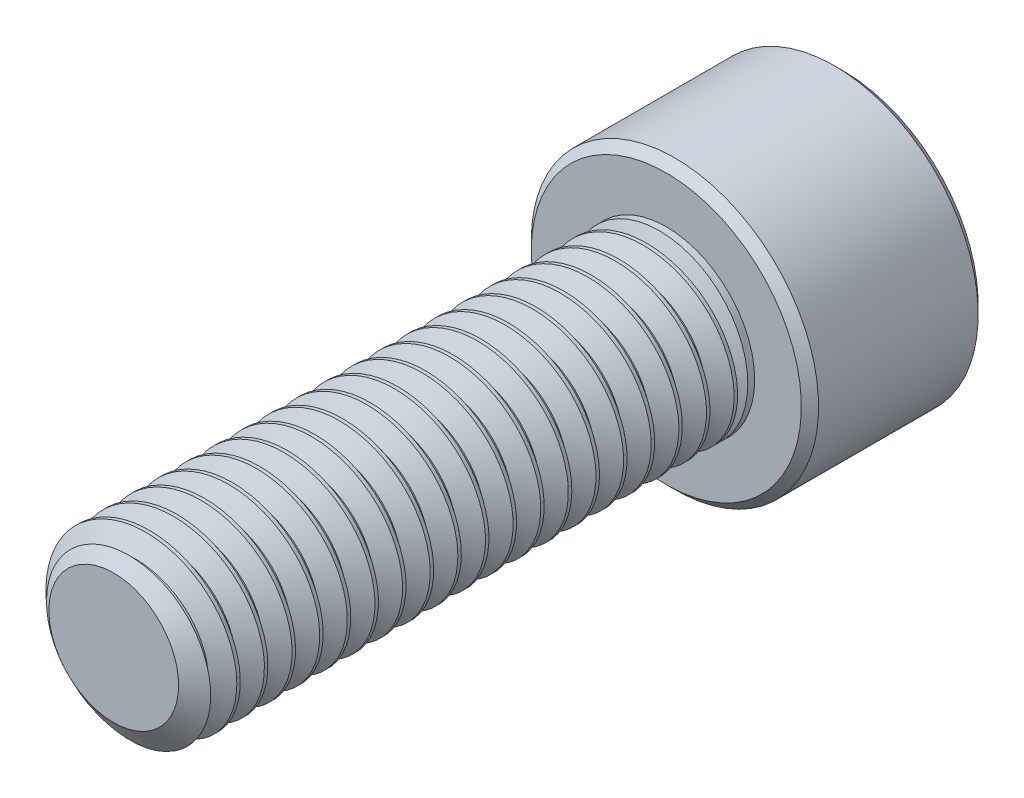
from build123d import *

# Parameters (mm, degrees)
SKETCH1_R          = 4
EXTRUDE1_DEPTH     = 25
CUT_SWEEP1_PITCH   = 1.25
SKETCH6_R          = 6.5
EXTRUDE2_DEPTH     = 8
CUT_EXTRUDE1_DEPTH = 4.5
CHAMFER1_SIZE      = 0.39


with BuildPart() as part:
    # Sketch1 → Extrude1 (new body)
    with BuildSketch(Plane.XY):
        Circle(SKETCH1_R)
    extrude(amount=-EXTRUDE1_DEPTH)

    # Cut-Sweep1: arcs per turn and ends read off the stored shape
    # Cut-Sweep1: the profile of Sketch3 profile screwed along a right-hand helix through 23 turns, 6 arcs to a turn; built about Z, then put on its axis
    cut_sweep1_z = Axis((0, 0, 0), (0, 0, 1))
    cut_sweep1_corners = [(4.0003, 0, -2.343923205), (3.188101184, 0, -1.875), (3.188101184, 0, -1.71875), (4.0003, 0, -1.249826795)]
    with BuildLine(mode=Mode.PRIVATE) as cut_sweep1_profile:
        Line(cut_sweep1_corners[0], cut_sweep1_corners[1])
        Line(cut_sweep1_corners[1], cut_sweep1_corners[2])
        Line(cut_sweep1_corners[2], cut_sweep1_corners[3])
        Line(cut_sweep1_corners[3], cut_sweep1_corners[0])
    cut_sweep1_cap = Face(cut_sweep1_profile.wire())
    cut_sweep1_turn_angles = [0, 30, 60, 90, 120, 150, 180, 210, 240, 270, 300, 330, 360]
    cut_sweep1_turn_weights = [1, 0.8660254037844387, 1, 0.8660254037844387, 1, 0.8660254037844387, 1, 0.8660254037844387, 1, 0.8660254037844387, 1, 0.8660254037844387, 1]
    cut_sweep1_turn_rails = [Edge.make_bspline([Vector(p[0], p[1], 0).rotate(cut_sweep1_z, cut_sweep1_turn_angles[k]) / cut_sweep1_turn_weights[k] + Vector(0, 0, p[2] + CUT_SWEEP1_PITCH * cut_sweep1_turn_angles[k] / 360) for k in range(13)], [0, 0, 0, 1, 1, 2, 2, 3, 3, 4, 4, 5, 5, 6, 6, 6], 2, cut_sweep1_turn_weights) for p in cut_sweep1_corners]
    cut_sweep1_turn_sides = [Face.make_surface_from_curves(cut_sweep1_turn_rails[p[0]], cut_sweep1_turn_rails[p[1]]) for p in [(0, 1), (1, 2), (2, 3), (3, 0)]]
    cut_sweep1 = Plane(origin=(0, 0, 0), x_dir=(0, 1, 0), z_dir=(0, 0, -1)) * Solid(Shell([*[p.moved(Location((0, 0, CUT_SWEEP1_PITCH * i))) for i in range(23) for p in cut_sweep1_turn_sides], cut_sweep1_cap, cut_sweep1_cap.rotate(cut_sweep1_z, 8280).moved(Location((0, 0, CUT_SWEEP1_PITCH * 8280 / 360)))]))
    add(cut_sweep1, mode=Mode.SUBTRACT)

    # Sketch4 → Cut-Revolve1 (revolve, cut)
    with BuildSketch(Plane(origin=(0, 0, 0), x_dir=(0, 0, -1), z_dir=(1, 0, 0)), mode=Mode.PRIVATE) as cut_revolve1_sk:
        Polygon((0.746350386, 4), (0, 2.934101184), (0, 4), align=None)
    revolve(cut_revolve1_sk.sketch.rotate(Axis((0, 0, 0), (0, 0, -1)), 90), axis=Axis((0, 0, 0), (0, 0, -1)), mode=Mode.SUBTRACT)

    # Sketch6 → Extrude2 (add)
    with BuildSketch(Plane(origin=(0, 0, -25), x_dir=(-1, 0, 0), z_dir=(0, 0, -1))):
        Circle(SKETCH6_R)
    extrude(amount=EXTRUDE2_DEPTH)

    # Sketch7 → Cut-Extrude1 (cut)
    with BuildSketch(Plane(origin=(0, 0, -33), x_dir=(-1, 0, 0), z_dir=(0, 0, -1))):
        Polygon((0, 3.464101615), (-3, 1.732050808), (-3, -1.732050808), (0, -3.464101615), (3, -1.732050808), (3, 1.732050808), align=None)
    extrude(amount=-CUT_EXTRUDE1_DEPTH, mode=Mode.SUBTRACT)

    # Cut-Extrude2 cone 1 section (through the dimple's axis) → Cut-Extrude2 (revolve, cut)
    with BuildSketch(Plane(origin=(0, 0, -33), x_dir=(0, 1, 0), z_dir=(1, 0, 0))):
        Polygon((0, 0), (3.464101615, 0), (0, 3.464101615), align=None)
    revolve(axis=Axis((0, 0, -33), (0, 0, 1)), mode=Mode.SUBTRACT)

    # Chamfer1
    chamfer1_edges = [part.edges().sort_by_distance(p)[0] for p in [
        (6.5, 0, -25),
        (6.5, 0, -33),
    ]]
    chamfer(chamfer1_edges, length=CHAMFER1_SIZE)

    # Sketch10 → Revolve1 (revolve)
    with BuildSketch(Plane(origin=(0, 0, 0), x_dir=(0, 0, -1), z_dir=(1, 0, 0)), mode=Mode.PRIVATE) as revolve1_sk:
        Polygon((25, 4), (25, 0), (23.030645751, 0), (24.6875, 4), align=None)
    revolve(revolve1_sk.sketch.rotate(Axis((0, 0, -25), (0, 0, 1)), 270), axis=Axis((0, 0, -25), (0, 0, 1)))


solid = part.part
